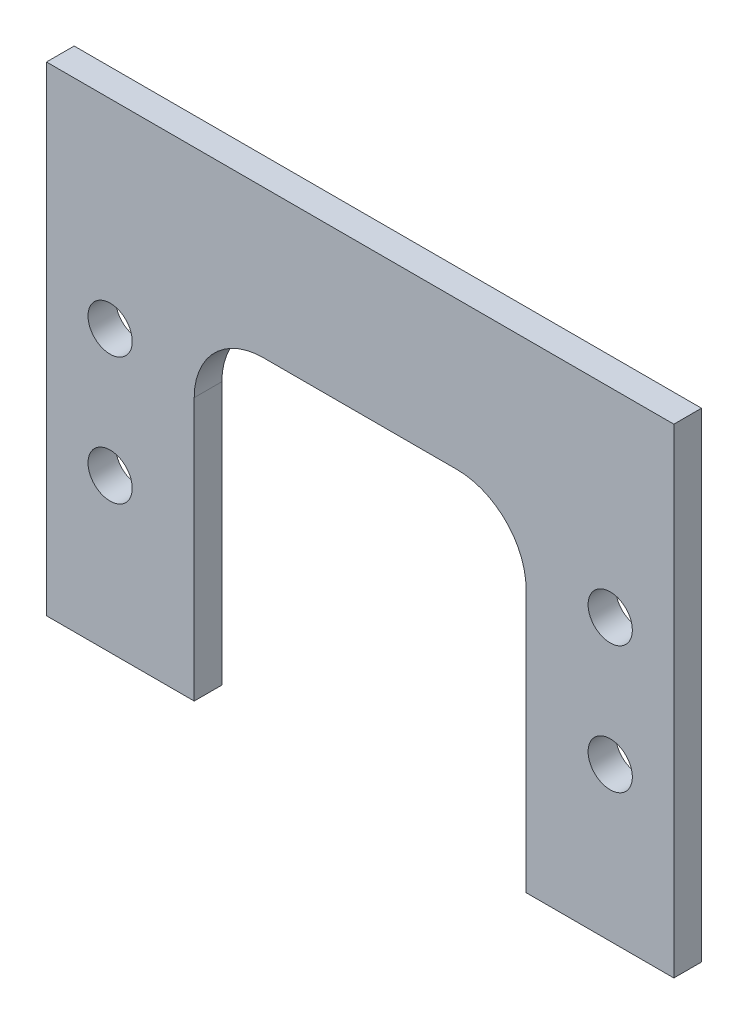
from build123d import *

# Parameters (mm, degrees)
SKETCH1_R           = 1.6
BOSS_EXTRUDE1_DEPTH = 2


with BuildPart() as part:
    # Sketch1 → Boss-Extrude1 (new body)
    with BuildSketch(Plane.XY):
        with BuildLine():
            Line((22.679489609, 22.679489609), (22.679489609, -12))
            Line((22.679489609, -12), (12, -12))
            Line((12, -12), (12, 7))
            ThreePointArc((12, 7), (10.535533906, 10.535533906), (7, 12))
            Line((7, 12), (-7, 12))
            ThreePointArc((-7, 12), (-10.535533906, 10.535533906), (-12, 7))
            Line((-12, 7), (-12, -12))
            Line((-12, -12), (-22.679489609, -12))
            Line((-22.679489609, -12), (-22.679489609, 22.679489609))
            Line((-22.679489609, 22.679489609), (22.679489609, 22.679489609))
        make_face()
        with Locations((-18.079489609, -0.91863806)):
            Circle(SKETCH1_R, mode=Mode.SUBTRACT)
        with Locations((-18.079489609, 8.28136194)):
            Circle(SKETCH1_R, mode=Mode.SUBTRACT)
        with Locations((18.079489609, 8.28136194)):
            Circle(SKETCH1_R, mode=Mode.SUBTRACT)
        with Locations((18.079489609, -0.91863806)):
            Circle(SKETCH1_R, mode=Mode.SUBTRACT)
    extrude(amount=BOSS_EXTRUDE1_DEPTH)


solid = part.part
